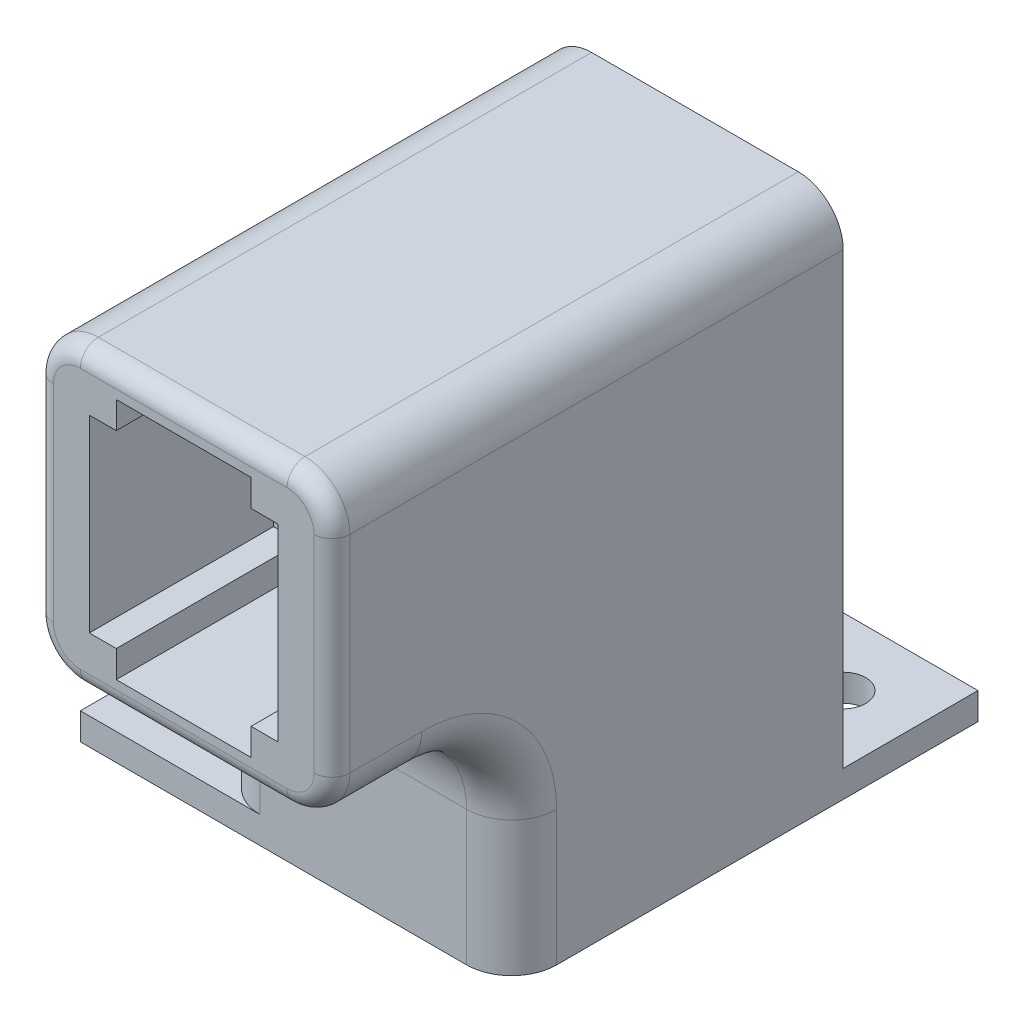
from build123d import *

# Parameters (mm, degrees)
SKETCH1_W           = 33
SKETCH1_H           = 33
BOSS_EXTRUDE1_DEPTH = 20
SHELL1_T            = -6
SKETCH2_W           = 33
SKETCH2_H           = 55
BOSS_EXTRUDE2_DEPTH = 36.9
SKETCH5_W           = 48
SKETCH5_H           = 51.9
BOSS_EXTRUDE3_DEPTH = 3
SKETCH6_R           = 2.5
CUT_EXTRUDE1_DEPTH  = 83.508242013
SKETCH7_W           = 15
SKETCH7_H           = 50
CUT_EXTRUDE2_DEPTH  = 3
SKETCH9_W           = 21
SKETCH9_H           = 21
CUT_EXTRUDE3_DEPTH  = 39
SKETCH10_R          = 5
BOSS_EXTRUDE4_DEPTH = 7.5
SKETCH12_W          = 28
SKETCH12_H          = 21
CUT_EXTRUDE4_DEPTH  = 19
SKETCH13_R          = 2
BOSS_EXTRUDE5_DEPTH = 13.5
FILLET1_R           = 10
BOSS_EXTRUDE6_START = -25
SKETCH14_W          = 3
SKETCH14_H          = 3
BOSS_EXTRUDE6_DEPTH = 4.5
FILLET2_R           = 2
FILLET3_R           = 5
FILLET4_R           = 5


with BuildPart() as part:
    # Sketch1 → Boss-Extrude1 (new body)
    with BuildSketch(Plane.XY):
        with Locations((16.5, 16.5)):
            Rectangle(SKETCH1_W, SKETCH1_H)
    extrude(amount=BOSS_EXTRUDE1_DEPTH)

    # Shell1
    shell1_openings = [part.faces().sort_by_distance(p)[0] for p in [
        (16.5, 16.5, 20),
    ]]
    offset(amount=SHELL1_T, openings=shell1_openings, kind=Kind.INTERSECTION)

    # Sketch2 → Boss-Extrude2 (add)
    with BuildSketch(Plane(origin=(0, 0, 0), x_dir=(-1, 0, 0), z_dir=(0, 0, -1))):
        with Locations((-16.5, 5.5)):
            Rectangle(SKETCH2_W, SKETCH2_H)
    extrude(amount=BOSS_EXTRUDE2_DEPTH)

    # Sketch5 → Boss-Extrude3 (add)
    with BuildSketch(Plane.XZ.offset(22)):
        with Locations((9, -25.95)):
            Rectangle(SKETCH5_W, SKETCH5_H)
    extrude(amount=BOSS_EXTRUDE3_DEPTH)

    # Sketch6 → Cut-Extrude1 (cut, through all)
    with BuildSketch(Plane(origin=(0, -22, 0), x_dir=(1, 0, 0), z_dir=(0, 1, 0))):
        with Locations(Location((-7.5, 7.5, 0), (0, 0, 270))):
            Circle(SKETCH6_R)
        with Locations(Location((-7.5, 44.4, 0), (0, 0, 270))):
            Circle(SKETCH6_R)
        with Locations(Location((25.5, 44.4, 0), (0, 0, 270))):
            Circle(SKETCH6_R)
    extrude(amount=-CUT_EXTRUDE1_DEPTH, mode=Mode.SUBTRACT)

    # Sketch7 → Cut-Extrude2 (cut)
    with BuildSketch(Plane.XZ.offset(-27)):
        with Locations((16.5, -5)):
            Rectangle(SKETCH7_W, SKETCH7_H)
    cut_extrude2 = extrude(amount=-CUT_EXTRUDE2_DEPTH, mode=Mode.SUBTRACT)

    # Mirror2: Cut-Extrude2 across plane
    add(cut_extrude2.mirror(Plane(origin=(0, 16.5, 0), x_dir=(0, 0, 1), z_dir=(0, -1, 0))), mode=Mode.SUBTRACT)

    # Sketch9 → Cut-Extrude3 (cut)
    with BuildSketch(Plane.XY.offset(6)):
        with Locations((16.5, 16.5)):
            Rectangle(SKETCH9_W, SKETCH9_H)
    extrude(amount=-CUT_EXTRUDE3_DEPTH, mode=Mode.SUBTRACT)

    # Sketch10 → Boss-Extrude4 (add)
    with BuildSketch(Plane.ZY.offset(-27)):
        with Locations((-18.45, 16.5)):
            Circle(SKETCH10_R)
    extrude(amount=BOSS_EXTRUDE4_DEPTH)

    # Sketch12 → Cut-Extrude4 (cut)
    with BuildSketch(Plane(origin=(6, 0, 0), x_dir=(0, 0, -1), z_dir=(1, 0, 0))):
        with Locations((19, 16.5)):
            Rectangle(SKETCH12_W, SKETCH12_H)
    extrude(amount=-CUT_EXTRUDE4_DEPTH, mode=Mode.SUBTRACT)

    # Sketch13 → Boss-Extrude5 (add)
    with BuildSketch(Plane.ZY.offset(-19.5)):
        with Locations(Location((-18.45, 16.5, 0), (0, 0, 180))):
            Circle(SKETCH13_R)
    extrude(amount=BOSS_EXTRUDE5_DEPTH)

    # Fillet1
    fillet1_edges = [part.edges().sort_by_distance(p)[0] for p in [
        (16.5, 0, 0),
    ]]
    fillet(fillet1_edges, radius=FILLET1_R)

    # Sketch14 → Boss-Extrude6 (add)
    with BuildSketch(Plane.XY.offset(20).offset(BOSS_EXTRUDE6_START)):
        with Locations((7.5, 7.5)):
            Rectangle(SKETCH14_W, SKETCH14_H)
        with Locations((7.5, 25.5)):
            Rectangle(SKETCH14_W, SKETCH14_H)
        with Locations((25.5, 25.5)):
            Rectangle(SKETCH14_W, SKETCH14_H)
        with Locations((25.5, 7.5)):
            Rectangle(SKETCH14_W, SKETCH14_H)
    extrude(amount=BOSS_EXTRUDE6_DEPTH)

    # Fillet2
    fillet2_edges = [part.edges().sort_by_distance(p)[0] for p in [
        (33, 16.5, 20),
        (16.5, 33, 20),
        (0, 16.5, 20),
        (16.5, 0, 20),
    ]]
    fillet(fillet2_edges, radius=FILLET2_R)

    # Fillet3
    # the kernel refuses this fillet: 5 mm, written as the material it takes off along each edge
    with BuildSketch(Plane(origin=(5, 28, 20), x_dir=(0, 1, 0), z_dir=(1, 0, 0))) as fillet3_piece_1:
        with BuildLine():
            CenterArc((3, -2), 2, 0, 90)
            Line((5, -2), (5, 0))
            Line((5, 0), (3, 0))
        make_face()
    revolve(axis=Axis((5, 28, 20), (0, 0, 1)), revolution_arc=90, mode=Mode.SUBTRACT)
    with BuildSketch(Plane(origin=(28, 28, 20), x_dir=(1, 0, 0), z_dir=(0, -1, 0))) as fillet3_piece_2:
        with BuildLine():
            CenterArc((3, -2), 2, 0, 90)
            Line((5, -2), (5, 0))
            Line((5, 0), (3, 0))
        make_face()
    revolve(axis=Axis((28, 28, 20), (0, 0, 1)), revolution_arc=90, mode=Mode.SUBTRACT)
    with BuildSketch(Plane(origin=(0, 6, -33), x_dir=(0, 0, -1), z_dir=(0, 1, 0)), Plane(origin=(0, 27, -5), x_dir=(0, 0, 1), z_dir=(0, -1, 0))) as fillet3_piece_3:
        with BuildLine():
            CenterArc((FILLET3_R, -FILLET3_R), FILLET3_R, 90, 90)
            Line((0, -FILLET3_R), (-FILLET3_R * 0.02, -FILLET3_R))
            Line((-FILLET3_R * 0.02, -FILLET3_R), (-FILLET3_R * 0.02, FILLET3_R * 0.02))
            Line((-FILLET3_R * 0.02, FILLET3_R * 0.02), (FILLET3_R, FILLET3_R * 0.02))
            Line((FILLET3_R, FILLET3_R * 0.02), (FILLET3_R, 0))
        make_face()
    extrude(amount=21, mode=Mode.SUBTRACT)
    with BuildSketch(Plane(origin=(0, 6, -5), x_dir=(0, -1, 0), z_dir=(0, 0, -1)), Plane(origin=(0, 27, -33), x_dir=(0, 1, 0), z_dir=(0, 0, 1))) as fillet3_piece_4:
        with BuildLine():
            CenterArc((FILLET3_R, -FILLET3_R), FILLET3_R, 90, 90)
            Line((0, -FILLET3_R), (-FILLET3_R * 0.02, -FILLET3_R))
            Line((-FILLET3_R * 0.02, -FILLET3_R), (-FILLET3_R * 0.02, FILLET3_R * 0.02))
            Line((-FILLET3_R * 0.02, FILLET3_R * 0.02), (FILLET3_R, FILLET3_R * 0.02))
            Line((FILLET3_R, FILLET3_R * 0.02), (FILLET3_R, 0))
        make_face()
    extrude(amount=28, mode=Mode.SUBTRACT)
    with BuildSketch(Plane(origin=(33, 33, -36.9), x_dir=(0, -1, 0), z_dir=(0, 0, 1)), Plane(origin=(0, 33, 20), x_dir=(0, -1, 0), z_dir=(0, 0, -1))) as fillet3_piece_5:
        with BuildLine():
            CenterArc((FILLET3_R, -FILLET3_R), FILLET3_R, 90, 90)
            Line((0, -FILLET3_R), (-FILLET3_R * 0.02, -FILLET3_R))
            Line((-FILLET3_R * 0.02, -FILLET3_R), (-FILLET3_R * 0.02, FILLET3_R * 0.02))
            Line((-FILLET3_R * 0.02, FILLET3_R * 0.02), (FILLET3_R, FILLET3_R * 0.02))
            Line((FILLET3_R, FILLET3_R * 0.02), (FILLET3_R, 0))
        make_face()
    extrude(amount=56.9, mode=Mode.SUBTRACT)
    with BuildSketch(Plane(origin=(0, 6, -5), x_dir=(0, -1, 0), z_dir=(0, 0, -1))) as fillet3_piece_6a_section:
        with BuildLine():
            CenterArc((FILLET3_R, -FILLET3_R), FILLET3_R, 90, 90)
            Line((0, -FILLET3_R), (-FILLET3_R * 0.02, -FILLET3_R))
            Line((-FILLET3_R * 0.02, -FILLET3_R), (-FILLET3_R * 0.02, FILLET3_R * 0.02))
            Line((-FILLET3_R * 0.02, FILLET3_R * 0.02), (FILLET3_R, FILLET3_R * 0.02))
            Line((FILLET3_R, FILLET3_R * 0.02), (FILLET3_R, 0))
        make_face()
    fillet3_piece_6a = extrude(amount=40.5, mode=Mode.PRIVATE)
    fillet3_piece_6a = split(fillet3_piece_6a, bisect_by=Plane(origin=(1.131975571, 4.868024429, -33), z_dir=(0, 0, -1)), keep=Keep.TOP, mode=Mode.PRIVATE)
    with BuildSketch(Plane(origin=(0, -6.5, -33), x_dir=(0, 0, -1), z_dir=(0, 1, 0))) as fillet3_piece_6b_section:
        with BuildLine():
            CenterArc((FILLET3_R, -FILLET3_R), FILLET3_R, 90, 90)
            Line((0, -FILLET3_R), (-FILLET3_R * 0.02, -FILLET3_R))
            Line((-FILLET3_R * 0.02, -FILLET3_R), (-FILLET3_R * 0.02, FILLET3_R * 0.02))
            Line((-FILLET3_R * 0.02, FILLET3_R * 0.02), (FILLET3_R, FILLET3_R * 0.02))
            Line((FILLET3_R, FILLET3_R * 0.02), (FILLET3_R, 0))
        make_face()
    fillet3_piece_6b = extrude(amount=33.5, mode=Mode.PRIVATE)
    fillet3_piece_6b = split(fillet3_piece_6b, bisect_by=Plane(origin=(1.131975571, 6, -34.131975571), z_dir=(0, -1, 0)), keep=Keep.TOP, mode=Mode.PRIVATE)
    fillet3_piece_6 = fillet3_piece_6a & fillet3_piece_6b
    add(fillet3_piece_6, mode=Mode.SUBTRACT)
    with BuildSketch(Plane(origin=(0, 27, -45.5), x_dir=(0, 1, 0), z_dir=(0, 0, 1))) as fillet3_piece_7a_section:
        with BuildLine():
            CenterArc((FILLET3_R, -FILLET3_R), FILLET3_R, 90, 90)
            Line((0, -FILLET3_R), (-FILLET3_R * 0.02, -FILLET3_R))
            Line((-FILLET3_R * 0.02, -FILLET3_R), (-FILLET3_R * 0.02, FILLET3_R * 0.02))
            Line((-FILLET3_R * 0.02, FILLET3_R * 0.02), (FILLET3_R, FILLET3_R * 0.02))
            Line((FILLET3_R, FILLET3_R * 0.02), (FILLET3_R, 0))
        make_face()
    fillet3_piece_7a = extrude(amount=40.5, mode=Mode.PRIVATE)
    fillet3_piece_7a = split(fillet3_piece_7a, bisect_by=Plane(origin=(1.131975571, 28.131975571, -33), z_dir=(0, 0, -1)), keep=Keep.TOP, mode=Mode.PRIVATE)
    with BuildSketch(Plane(origin=(0, 6, -33), x_dir=(0, 0, -1), z_dir=(0, 1, 0))) as fillet3_piece_7b_section:
        with BuildLine():
            CenterArc((FILLET3_R, -FILLET3_R), FILLET3_R, 90, 90)
            Line((0, -FILLET3_R), (-FILLET3_R * 0.02, -FILLET3_R))
            Line((-FILLET3_R * 0.02, -FILLET3_R), (-FILLET3_R * 0.02, FILLET3_R * 0.02))
            Line((-FILLET3_R * 0.02, FILLET3_R * 0.02), (FILLET3_R, FILLET3_R * 0.02))
            Line((FILLET3_R, FILLET3_R * 0.02), (FILLET3_R, 0))
        make_face()
    fillet3_piece_7b = extrude(amount=33.5, mode=Mode.PRIVATE)
    fillet3_piece_7b = split(fillet3_piece_7b, bisect_by=Plane(origin=(1.131975571, 27, -34.131975571), z_dir=(0, 1, 0)), keep=Keep.TOP, mode=Mode.PRIVATE)
    fillet3_piece_7 = fillet3_piece_7a & fillet3_piece_7b
    add(fillet3_piece_7, mode=Mode.SUBTRACT)
    with BuildSketch(Plane(origin=(0, 27, -5), x_dir=(0, 0, 1), z_dir=(0, -1, 0))) as fillet3_piece_8a_section:
        with BuildLine():
            CenterArc((FILLET3_R, -FILLET3_R), FILLET3_R, 90, 90)
            Line((0, -FILLET3_R), (-FILLET3_R * 0.02, -FILLET3_R))
            Line((-FILLET3_R * 0.02, -FILLET3_R), (-FILLET3_R * 0.02, FILLET3_R * 0.02))
            Line((-FILLET3_R * 0.02, FILLET3_R * 0.02), (FILLET3_R, FILLET3_R * 0.02))
            Line((FILLET3_R, FILLET3_R * 0.02), (FILLET3_R, 0))
        make_face()
    fillet3_piece_8a = extrude(amount=33.5, mode=Mode.PRIVATE)
    fillet3_piece_8a = split(fillet3_piece_8a, bisect_by=Plane(origin=(1.131975571, 6, -3.868024429), z_dir=(0, -1, 0)), keep=Keep.TOP, mode=Mode.PRIVATE)
    with BuildSketch(Plane(origin=(0, 6, 7.5), x_dir=(0, -1, 0), z_dir=(0, 0, -1))) as fillet3_piece_8b_section:
        with BuildLine():
            CenterArc((FILLET3_R, -FILLET3_R), FILLET3_R, 90, 90)
            Line((0, -FILLET3_R), (-FILLET3_R * 0.02, -FILLET3_R))
            Line((-FILLET3_R * 0.02, -FILLET3_R), (-FILLET3_R * 0.02, FILLET3_R * 0.02))
            Line((-FILLET3_R * 0.02, FILLET3_R * 0.02), (FILLET3_R, FILLET3_R * 0.02))
            Line((FILLET3_R, FILLET3_R * 0.02), (FILLET3_R, 0))
        make_face()
    fillet3_piece_8b = extrude(amount=40.5, mode=Mode.PRIVATE)
    fillet3_piece_8b = split(fillet3_piece_8b, bisect_by=Plane(origin=(1.131975571, 4.868024429, -5), z_dir=(0, 0, 1)), keep=Keep.TOP, mode=Mode.PRIVATE)
    fillet3_piece_8 = fillet3_piece_8a & fillet3_piece_8b
    add(fillet3_piece_8, mode=Mode.SUBTRACT)
    with BuildSketch(Plane(origin=(0, 27, -33), x_dir=(0, 1, 0), z_dir=(0, 0, 1))) as fillet3_piece_9a_section:
        with BuildLine():
            CenterArc((FILLET3_R, -FILLET3_R), FILLET3_R, 90, 90)
            Line((0, -FILLET3_R), (-FILLET3_R * 0.02, -FILLET3_R))
            Line((-FILLET3_R * 0.02, -FILLET3_R), (-FILLET3_R * 0.02, FILLET3_R * 0.02))
            Line((-FILLET3_R * 0.02, FILLET3_R * 0.02), (FILLET3_R, FILLET3_R * 0.02))
            Line((FILLET3_R, FILLET3_R * 0.02), (FILLET3_R, 0))
        make_face()
    fillet3_piece_9a = extrude(amount=40.5, mode=Mode.PRIVATE)
    fillet3_piece_9a = split(fillet3_piece_9a, bisect_by=Plane(origin=(1.131975571, 28.131975571, -5), z_dir=(0, 0, 1)), keep=Keep.TOP, mode=Mode.PRIVATE)
    with BuildSketch(Plane(origin=(0, 39.5, -5), x_dir=(0, 0, 1), z_dir=(0, -1, 0))) as fillet3_piece_9b_section:
        with BuildLine():
            CenterArc((FILLET3_R, -FILLET3_R), FILLET3_R, 90, 90)
            Line((0, -FILLET3_R), (-FILLET3_R * 0.02, -FILLET3_R))
            Line((-FILLET3_R * 0.02, -FILLET3_R), (-FILLET3_R * 0.02, FILLET3_R * 0.02))
            Line((-FILLET3_R * 0.02, FILLET3_R * 0.02), (FILLET3_R, FILLET3_R * 0.02))
            Line((FILLET3_R, FILLET3_R * 0.02), (FILLET3_R, 0))
        make_face()
    fillet3_piece_9b = extrude(amount=33.5, mode=Mode.PRIVATE)
    fillet3_piece_9b = split(fillet3_piece_9b, bisect_by=Plane(origin=(1.131975571, 27, -3.868024429), z_dir=(0, 1, 0)), keep=Keep.TOP, mode=Mode.PRIVATE)
    fillet3_piece_9 = fillet3_piece_9a & fillet3_piece_9b
    add(fillet3_piece_9, mode=Mode.SUBTRACT)

    # Fillet4
    # the kernel refuses this fillet: 5 mm, written as the material it takes off along each edge
    with BuildSketch(Plane(origin=(5, 5, 20), x_dir=(-1, 0, 0), z_dir=(0, 1, 0))) as fillet4_piece_1:
        with BuildLine():
            CenterArc((3, -2), 2, 0, 90)
            Line((5, -2), (5, 0))
            Line((5, 0), (3, 0))
        make_face()
    revolve(axis=Axis((5, 5, 20), (0, 0, 1)), revolution_arc=90, mode=Mode.SUBTRACT)
    with BuildSketch(Plane(origin=(28, 5, 20), x_dir=(0, -1, 0), z_dir=(-1, 0, 0))) as fillet4_piece_2:
        with BuildLine():
            CenterArc((3, -2), 2, 0, 90)
            Line((5, -2), (5, 0))
            Line((5, 0), (3, 0))
        make_face()
    revolve(axis=Axis((28, 5, 20), (0, 0, 1)), revolution_arc=90, mode=Mode.SUBTRACT)
    with BuildSketch(Plane(origin=(33, 0, 10), x_dir=(-1, 0, 0), z_dir=(0, 0, 1))) as fillet4_piece_3:
        with BuildLine():
            CenterArc((FILLET4_R, -FILLET4_R), FILLET4_R, 90, 90)
            Line((0, -FILLET4_R), (0, 0))
            Line((0, 0), (FILLET4_R, 0))
        make_face()
    extrude(amount=10, mode=Mode.SUBTRACT)
    with BuildSketch(Plane(origin=(33, -10, 0), x_dir=(0, 0, -1), z_dir=(0, -1, 0))) as fillet4_piece_4:
        with BuildLine():
            CenterArc((FILLET4_R, -FILLET4_R), FILLET4_R, 90, 90)
            Line((0, -FILLET4_R), (0, 0))
            Line((0, 0), (FILLET4_R, 0))
        make_face()
    extrude(amount=27.5, mode=Mode.SUBTRACT)
    with BuildSketch(Plane(origin=(0, -22, 0), x_dir=(1, 0, 0), z_dir=(0, 1, 0))) as fillet4_piece_5:
        with BuildLine():
            CenterArc((FILLET4_R, FILLET4_R), FILLET4_R, 180, 90)
            Line((0, FILLET4_R), (0, 0))
            Line((0, 0), (FILLET4_R, 0))
        make_face()
    extrude(amount=12, mode=Mode.SUBTRACT)
    with BuildSketch(Plane(origin=(0, 0, 10), x_dir=(1, 0, 0), z_dir=(0, 0, 1))) as fillet4_piece_6:
        with BuildLine():
            CenterArc((FILLET4_R, FILLET4_R), FILLET4_R, 180, 90)
            Line((0, FILLET4_R), (0, 0))
            Line((0, 0), (FILLET4_R, 0))
        make_face()
    extrude(amount=10, mode=Mode.SUBTRACT)
    with BuildSketch(Plane(origin=(33, -10, 10), x_dir=(0, 1, 0), z_dir=(0, 0, 1))) as fillet4_piece_7:
        with BuildLine():
            CenterArc((10 + FILLET4_R, FILLET4_R), FILLET4_R, 180, 90)
            Line((10, FILLET4_R), (10, 0))
            Line((10, 0), (10 + FILLET4_R, 0))
        make_face()
    revolve(axis=Axis((33, -10, 10), (-1, 0, 0)), revolution_arc=90, mode=Mode.SUBTRACT)
    with BuildSketch(Plane(origin=(0, -10, 10), x_dir=(0, 1, 0), z_dir=(0, 0, 1))) as fillet4_piece_8:
        with BuildLine():
            CenterArc((10 + FILLET4_R, -FILLET4_R), FILLET4_R, 90, 90)
            Line((10 + FILLET4_R, 0), (10, 0))
            Line((10, 0), (10, -FILLET4_R))
        make_face()
    revolve(axis=Axis((0, -10, 10), (-1, 0, 0)), revolution_arc=90, mode=Mode.SUBTRACT)


solid = part.part
